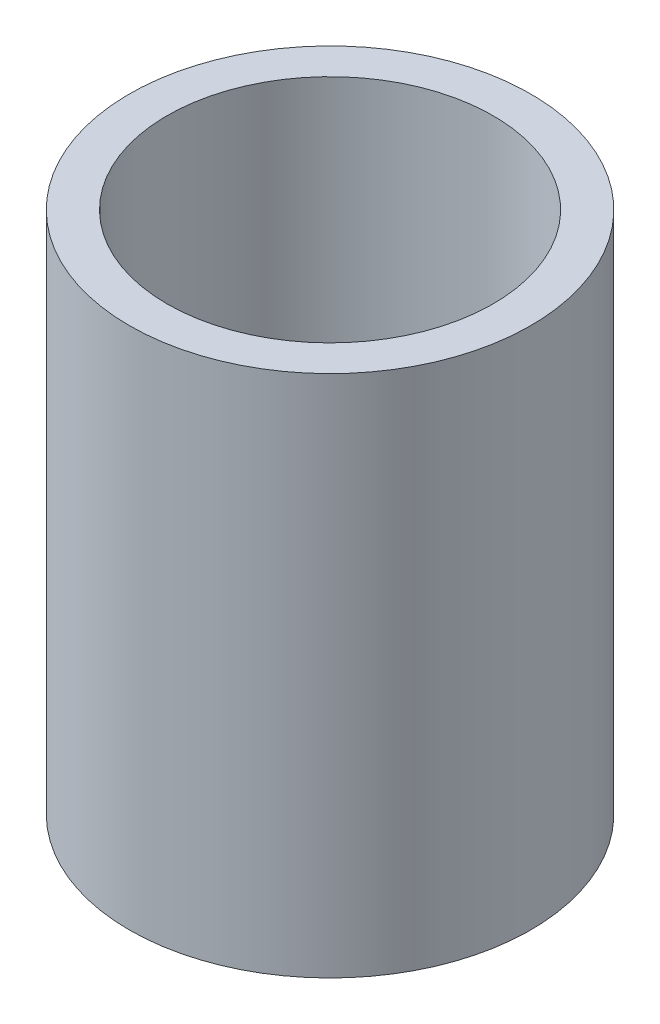
from build123d import *

# Parameters (mm, degrees)
SKETCH1_R           = 20.32
SKETCH1_R_2         = 16.51
BOSS_EXTRUDE1_DEPTH = 53


with BuildPart() as part:
    # Sketch1 → Boss-Extrude1 (new body)
    with BuildSketch(Plane(origin=(0, 0, 0), x_dir=(1, 0, 0), z_dir=(0, 1, 0))):
        Circle(SKETCH1_R)
        Circle(SKETCH1_R_2, mode=Mode.SUBTRACT)
    extrude(amount=BOSS_EXTRUDE1_DEPTH)


solid = part.part
